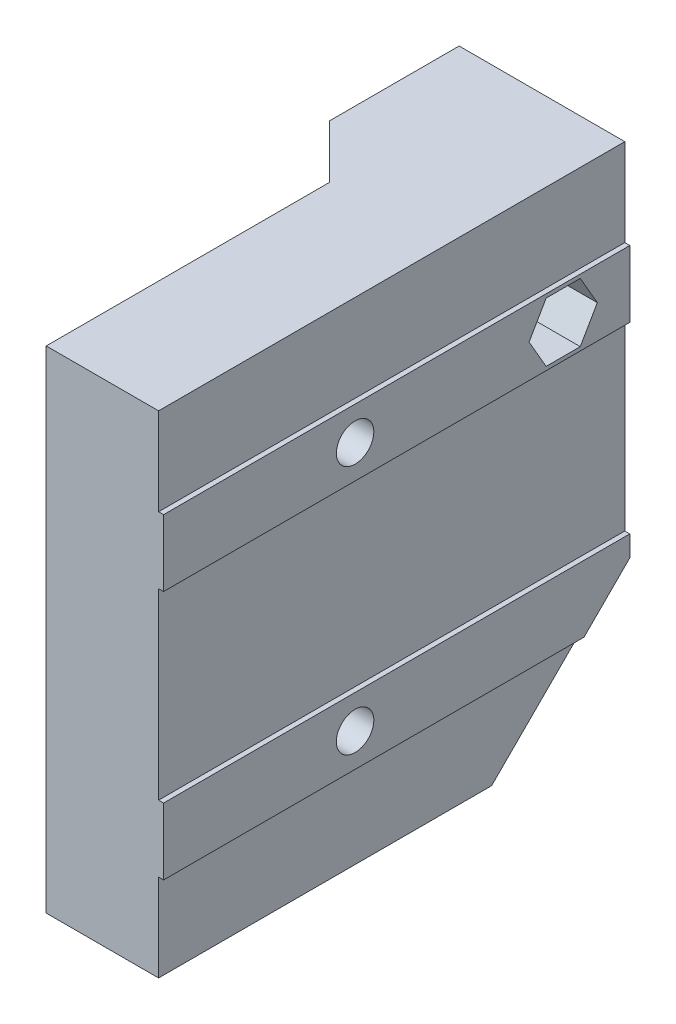
from build123d import *

# Parameters (mm, degrees)
BOSS_EXTRUDE1_DEPTH                          = 10
BOSS_EXTRUDE1_2_DEPTH                        = 10
CBORE_FOR_M5_HEX_SOCKET_HEAD_CAP_SCR_2_COUNT = 2
CBORE_FOR_M5_HEX_SOCKET_HEAD_CAP_SCR_2_PITCH = 30
BOSS_EXTRUDE2_DEPTH                          = 13
BOSS_EXTRUDE3_DEPTH                          = 23
BOSS_EXTRUDE4_DEPTH                          = 27
SKETCH8_R                                    = 2.1
CUT_EXTRUDE1_DEPTH                           = 52.298148115
CHAMFER1_SIZE                                = 16
CUT_EXTRUDE2_DEPTH                           = 6
SKETCH10_R                                   = 5
SKETCH10_R_2                                 = 2.1
BOSS_EXTRUDE5_DEPTH                          = 0.7
CHAMFER2_SIZE                                = 1


with BuildPart() as part:
    # Sketch1 → Boss-Extrude1 (new, symmetric)
    with BuildSketch(Plane.XY):
        with BuildLine():
            Line((-14, 32.5), (-1.5, 32.5))
            Line((-1.5, 32.5), (-1.5, 5.809475019))
            ThreePointArc((-1.5, 5.809475019), (-6, 0), (-1.5, -5.809475019))
            Line((-1.5, -5.809475019), (-1.5, -24.5))
            Line((-1.5, -24.5), (-14, -24.5))
            Line((-14, -24.5), (-14, 32.5))
        make_face()
    extrude(amount=BOSS_EXTRUDE1_DEPTH, both=True)


with BuildPart() as body_2:
    # Sketch1 → Boss-Extrude1 2 (new, symmetric)
    with BuildSketch(Plane.XY):
        with BuildLine():
            Line((15, 33.5), (15, 23))
            Line((15, 23), (15.6, 23))
            Line((15.6, 23), (15.6, 15))
            Line((15.6, 15), (15, 15))
            Line((15, 15), (15, -7))
            Line((15, -7), (15.6, -7))
            Line((15.6, -7), (15.6, -15))
            Line((15.6, -15), (15, -15))
            Line((15, -15), (15, -25.5))
            Line((15, -25.5), (1.5, -25.5))
            Line((1.5, -25.5), (1.5, -5.809475019))
            ThreePointArc((1.5, -5.809475019), (6, 0), (1.5, 5.809475019))
            Line((1.5, 5.809475019), (1.5, 33.5))
            Line((1.5, 33.5), (15, 33.5))
        make_face()
    extrude(amount=BOSS_EXTRUDE1_2_DEPTH, both=True)


with BuildPart() as cbore_for_m5_hex_socket_head_cap_screw1_tool:
    # Sketch2 → CBORE for M5 Hex Socket Head Cap Screw1 (revolve)
    with BuildSketch(Plane(origin=(-14, -11, 0), x_dir=(0, 0, 1), z_dir=(0, 1, 0))):
        Polygon((0, 0), (0, 29.6), (2.25, 29.6), (2.25, 5.9), (5, 5.9), (5, 0), align=None)
    cbore_for_m5_hex_socket_head_cap_screw1 = revolve(axis=Axis((-20.35, -11, 0), (1, 0, 0)))


with BuildPart() as part_1:
    add(part.part)

    # CBORE for M5 Hex Socket Head Cap Screw1: cut by cbore_for_m5_hex_socket_head_cap_screw1_tool
    add(cbore_for_m5_hex_socket_head_cap_screw1_tool.part, mode=Mode.SUBTRACT)


with BuildPart() as body_2_1:
    add(body_2.part)

    # CBORE for M5 Hex Socket Head Cap Screw1: cut by cbore_for_m5_hex_socket_head_cap_screw1_tool
    add(cbore_for_m5_hex_socket_head_cap_screw1_tool.part, mode=Mode.SUBTRACT)


with BuildPart() as cbore_for_m5_hex_socket_head_cap_scr_2_tool:
    # CBORE for M5 Hex Socket Head Cap Scr 2: CBORE for M5 Hex Socket Head Cap Screw1 ×2
    with Locations(*[(0, i * CBORE_FOR_M5_HEX_SOCKET_HEAD_CAP_SCR_2_PITCH, 0) for i in range(1, CBORE_FOR_M5_HEX_SOCKET_HEAD_CAP_SCR_2_COUNT)]):
        add(cbore_for_m5_hex_socket_head_cap_screw1)


with BuildPart() as part_2:
    add(part_1.part)

    # CBORE for M5 Hex Socket Head Cap Scr 2: cut by cbore_for_m5_hex_socket_head_cap_scr_2_tool
    add(cbore_for_m5_hex_socket_head_cap_scr_2_tool.part, mode=Mode.SUBTRACT)


with BuildPart() as body_2_2:
    add(body_2_1.part)

    # CBORE for M5 Hex Socket Head Cap Scr 2: cut by cbore_for_m5_hex_socket_head_cap_scr_2_tool
    add(cbore_for_m5_hex_socket_head_cap_scr_2_tool.part, mode=Mode.SUBTRACT)

    # Sketch4 → Boss-Extrude2 (add)
    with BuildSketch(Plane.XY.offset(10)):
        Polygon((1.5, 5.809475019), (1.5, -5.809475019), (1.5, -25.5), (15, -25.5), (15, -15), (15.6, -15), (15.6, -7), (15, -7), (15, 15), (15.6, 15), (15.6, 23), (15, 23), (15, 33.5), (1.5, 33.5), align=None)
    extrude(amount=BOSS_EXTRUDE2_DEPTH)

    # Sketch5 → Boss-Extrude3 (add)
    with BuildSketch(Plane(origin=(0, 0, -10), x_dir=(-1, 0, 0), z_dir=(0, 0, -1))):
        with BuildLine():
            Line((-15, -25.5), (-1.5, -25.5))
            Line((-1.5, -25.5), (-1.5, -5.809475019))
            ThreePointArc((-1.5, -5.809475019), (-6, 0), (-1.5, 5.809475019))
            Line((-1.5, 5.809475019), (-1.5, 33.5))
            Line((-1.5, 33.5), (-15, 33.5))
            Line((-15, 33.5), (-15, 23))
            Line((-15, 23), (-15.6, 23))
            Line((-15.6, 23), (-15.6, 15))
            Line((-15.6, 15), (-15, 15))
            Line((-15, 15), (-15, -7))
            Line((-15, -7), (-15.6, -7))
            Line((-15.6, -7), (-15.6, -15))
            Line((-15.6, -15), (-15, -15))
            Line((-15, -15), (-15, -25.5))
        make_face()
    extrude(amount=BOSS_EXTRUDE3_DEPTH)

    # Sketch7 → Boss-Extrude4 (add)
    with BuildSketch(Plane(origin=(0, 33.5, 0), x_dir=(1, 0, 0), z_dir=(0, 1, 0))):
        Polygon((1.5, 33), (-4.9, 33), (-4.9, 17.4), (1.5, 11), align=None)
    extrude(amount=-BOSS_EXTRUDE4_DEPTH)

    # Sketch8 → Cut-Extrude1 (cut, through all)
    with BuildSketch(Plane.ZY.offset(4.9)):
        with Locations((-25, 19)):
            Circle(SKETCH8_R)
    extrude(amount=-CUT_EXTRUDE1_DEPTH, mode=Mode.SUBTRACT)

    # Chamfer1
    chamfer1_edges = [body_2_2.edges().sort_by_distance(p)[0] for p in [
        (8.25, -25.5, -33),
    ]]
    chamfer(chamfer1_edges, length=CHAMFER1_SIZE)

    # Sketch9 → Cut-Extrude2 (cut)
    with BuildSketch(Plane(origin=(15.6, 0, 0), x_dir=(0, 0, -1), z_dir=(1, 0, 0))):
        Polygon((29.099186911, 19), (27.049593456, 22.55), (22.950406544, 22.55), (20.900813089, 19), (22.950406544, 15.45), (27.049593456, 15.45), align=None)
    extrude(amount=-CUT_EXTRUDE2_DEPTH, mode=Mode.SUBTRACT)

    # Sketch10 → Boss-Extrude5 (add)
    with BuildSketch(Plane.ZY.offset(4.9)):
        with Locations((-25, 19)):
            Circle(SKETCH10_R)
        with Locations((-25, 19)):
            Circle(SKETCH10_R_2, mode=Mode.SUBTRACT)
    extrude(amount=BOSS_EXTRUDE5_DEPTH)

    # Chamfer2
    # the kernel refuses this chamfer: 1 mm, written as the material it takes off along each edge
    with BuildSketch(Plane(origin=(-5.6, 19, -25), x_dir=(0, 0, 1), z_dir=(0, -1, 0))) as chamfer2_piece_1_section:
        Polygon((5, -CHAMFER2_SIZE), (5 - CHAMFER2_SIZE, 0), (5, 0), align=None)
    chamfer2_piece_1 = revolve(axis=Axis((-5.6, 19, -25), (-1, 0, 0)), mode=Mode.PRIVATE)
    chamfer2_piece_1 = split(chamfer2_piece_1, bisect_by=Plane(origin=(-4.9, 19, -29.353058273), z_dir=(-1, 0, 0)), keep=Keep.TOP, mode=Mode.PRIVATE)
    add(chamfer2_piece_1, mode=Mode.SUBTRACT)


solid = body_2_2.part
